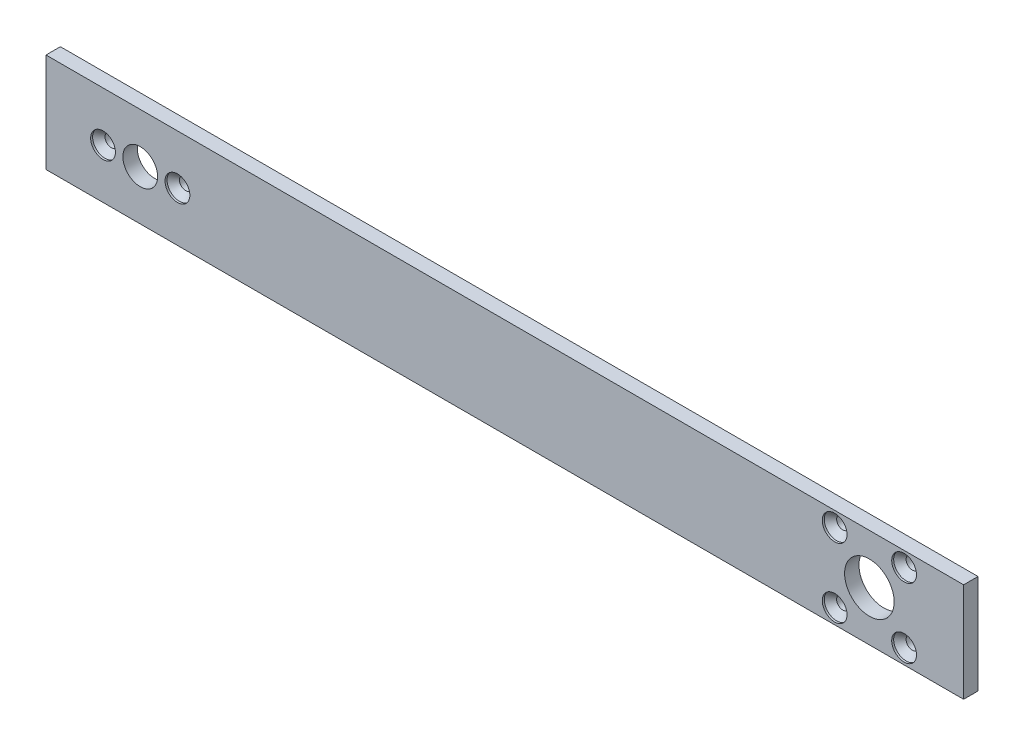
from build123d import *

# Parameters (mm, degrees)
SKETCH1_W                       = 185
SKETCH1_H                       = 20
BASE_SHAPE_DEPTH                = 2.9
MOTOR_CUTOUTS_REACH             = 95.084
SKETCH2_R                       = 1.25
SKETCH2_R_2                     = 3.5
SKETCH2_R_3                     = 5
COUNTERSUNK_CHAMFERS_AT_2_COUNT = 2
COUNTERSUNK_CHAMFERS_AT_2_PITCH = 15
COUNTERSUNK_CHAMFERS_AT_3_COUNT = 2
COUNTERSUNK_CHAMFERS_AT_3_PITCH = 147.666008275
COUNTERSUNK_CHAMFERS_AT_4_COUNT = 2
COUNTERSUNK_CHAMFERS_AT_4_PITCH = 161.651631603
COUNTERSUNK_CHAMFERS_AT_5_COUNT = 2
COUNTERSUNK_CHAMFERS_AT_5_PITCH = 147.666008275
COUNTERSUNK_CHAMFERS_AT_6_COUNT = 2
COUNTERSUNK_CHAMFERS_AT_6_PITCH = 161.651631603
PCB_SLOT_DEPTH                  = 1.5


with BuildPart() as part:
    # Sketch1 → Base shape (new body)
    with BuildSketch(Plane.XY):
        Rectangle(SKETCH1_W, SKETCH1_H)
    extrude(amount=-BASE_SHAPE_DEPTH)

    # Sketch2 → Motor cutouts (cut, up to next)
    with BuildSketch(Plane.XY, mode=Mode.PRIVATE) as motor_cutouts_sk1:
        with Locations((-81, 0)):
            Circle(SKETCH2_R)
    motor_cutouts_tool1 = extrude(motor_cutouts_sk1.sketch, amount=-MOTOR_CUTOUTS_REACH, mode=Mode.PRIVATE) & part.part
    # Sketch2 → Motor cutouts (cut, up to next)
    with BuildSketch(Plane.XY, mode=Mode.PRIVATE) as motor_cutouts_sk2:
        with Locations((-66, 0)):
            Circle(SKETCH2_R)
    motor_cutouts_tool2 = extrude(motor_cutouts_sk2.sketch, amount=-MOTOR_CUTOUTS_REACH, mode=Mode.PRIVATE) & part.part
    # Sketch2 → Motor cutouts (cut, up to next)
    with BuildSketch(Plane.XY, mode=Mode.PRIVATE) as motor_cutouts_sk3:
        with Locations((-73.5, 0)):
            Circle(SKETCH2_R_2)
    motor_cutouts_tool3 = extrude(motor_cutouts_sk3.sketch, amount=-MOTOR_CUTOUTS_REACH, mode=Mode.PRIVATE) & part.part
    # Sketch2 → Motor cutouts (cut, up to next)
    with BuildSketch(Plane.XY, mode=Mode.PRIVATE) as motor_cutouts_sk4:
        with Locations((73.5, 0)):
            Circle(SKETCH2_R_3)
    motor_cutouts_tool4 = extrude(motor_cutouts_sk4.sketch, amount=-MOTOR_CUTOUTS_REACH, mode=Mode.PRIVATE) & part.part
    # Sketch2 → Motor cutouts (cut, up to next)
    with BuildSketch(Plane.XY, mode=Mode.PRIVATE) as motor_cutouts_sk5:
        with Locations((66.5, 7)):
            Circle(SKETCH2_R)
    motor_cutouts_tool5 = extrude(motor_cutouts_sk5.sketch, amount=-MOTOR_CUTOUTS_REACH, mode=Mode.PRIVATE) & part.part
    # Sketch2 → Motor cutouts (cut, up to next)
    with BuildSketch(Plane.XY, mode=Mode.PRIVATE) as motor_cutouts_sk6:
        with Locations((80.5, 7)):
            Circle(SKETCH2_R)
    motor_cutouts_tool6 = extrude(motor_cutouts_sk6.sketch, amount=-MOTOR_CUTOUTS_REACH, mode=Mode.PRIVATE) & part.part
    # Sketch2 → Motor cutouts (cut, up to next)
    with BuildSketch(Plane.XY, mode=Mode.PRIVATE) as motor_cutouts_sk7:
        with Locations((80.5, -7)):
            Circle(SKETCH2_R)
    motor_cutouts_tool7 = extrude(motor_cutouts_sk7.sketch, amount=-MOTOR_CUTOUTS_REACH, mode=Mode.PRIVATE) & part.part
    # Sketch2 → Motor cutouts (cut, up to next)
    with BuildSketch(Plane.XY, mode=Mode.PRIVATE) as motor_cutouts_sk8:
        with Locations((66.5, -7)):
            Circle(SKETCH2_R)
    motor_cutouts_tool8 = extrude(motor_cutouts_sk8.sketch, amount=-MOTOR_CUTOUTS_REACH, mode=Mode.PRIVATE) & part.part
    add(motor_cutouts_tool1.solids().sort_by_distance((-81, 0, 0))[0], mode=Mode.SUBTRACT)
    add(motor_cutouts_tool2.solids().sort_by_distance((-66, 0, 0))[0], mode=Mode.SUBTRACT)
    add(motor_cutouts_tool3.solids().sort_by_distance((-73.5, 0, 0))[0], mode=Mode.SUBTRACT)
    add(motor_cutouts_tool4.solids().sort_by_distance((73.5, 0, 0))[0], mode=Mode.SUBTRACT)
    add(motor_cutouts_tool5.solids().sort_by_distance((66.5, 7, 0))[0], mode=Mode.SUBTRACT)
    add(motor_cutouts_tool6.solids().sort_by_distance((80.5, 7, 0))[0], mode=Mode.SUBTRACT)
    add(motor_cutouts_tool7.solids().sort_by_distance((80.5, -7, 0))[0], mode=Mode.SUBTRACT)
    add(motor_cutouts_tool8.solids().sort_by_distance((66.5, -7, 0))[0], mode=Mode.SUBTRACT)

    # Sketch4 → Countersunk chamfers (revolve, cut)
    with BuildSketch(Plane(origin=(-81, 0, 0), x_dir=(0, -1, 0), z_dir=(1, 0, 0))):
        Polygon((0, 0), (0, 2.9), (1.25, 2.9), (1.25, 1.65), (2.5, 0.4), (2.5, 0), align=None)
    countersunk_chamfers = revolve(axis=Axis((-81, 0, 6.35), (0, 0, -1)), mode=Mode.SUBTRACT)

    # Countersunk chamfers at 2: Countersunk chamfers ×2
    with Locations(*[(i * COUNTERSUNK_CHAMFERS_AT_2_PITCH, 0, 0) for i in range(1, COUNTERSUNK_CHAMFERS_AT_2_COUNT)]):
        add(countersunk_chamfers, mode=Mode.SUBTRACT)

    # Countersunk chamfers at 3: Countersunk chamfers ×2
    with Locations(*[Vector(0.9988757854473691, 0.047404274563603965, 0) * (i * COUNTERSUNK_CHAMFERS_AT_3_PITCH) for i in range(1, COUNTERSUNK_CHAMFERS_AT_3_COUNT)]):
        add(countersunk_chamfers, mode=Mode.SUBTRACT)

    # Countersunk chamfers at 4: Countersunk chamfers ×2
    with Locations(*[Vector(0.9990619853213468, 0.043302996267798335, 0) * (i * COUNTERSUNK_CHAMFERS_AT_4_PITCH) for i in range(1, COUNTERSUNK_CHAMFERS_AT_4_COUNT)]):
        add(countersunk_chamfers, mode=Mode.SUBTRACT)

    # Countersunk chamfers at 5: Countersunk chamfers ×2
    with Locations(*[Vector(0.9988757854473691, -0.04740427456360395, 0) * (i * COUNTERSUNK_CHAMFERS_AT_5_PITCH) for i in range(1, COUNTERSUNK_CHAMFERS_AT_5_COUNT)]):
        add(countersunk_chamfers, mode=Mode.SUBTRACT)

    # Countersunk chamfers at 6: Countersunk chamfers ×2
    with Locations(*[Vector(0.9990619853213468, -0.0433029962677983, 0) * (i * COUNTERSUNK_CHAMFERS_AT_6_PITCH) for i in range(1, COUNTERSUNK_CHAMFERS_AT_6_COUNT)]):
        add(countersunk_chamfers, mode=Mode.SUBTRACT)

    # Sketch5 → PCB slot (cut)
    with BuildSketch(Plane(origin=(0, 0, -2.9), x_dir=(-1, 0, 0), z_dir=(0, 0, -1))):
        with BuildLine():
            Line((-60, -6), (60, -6))
            ThreePointArc((60, -6), (61, -7), (60, -8))
            Line((60, -8), (-60, -8))
            ThreePointArc((-60, -8), (-61, -7), (-60, -6))
        make_face()
    extrude(amount=-PCB_SLOT_DEPTH, mode=Mode.SUBTRACT)


solid = part.part
